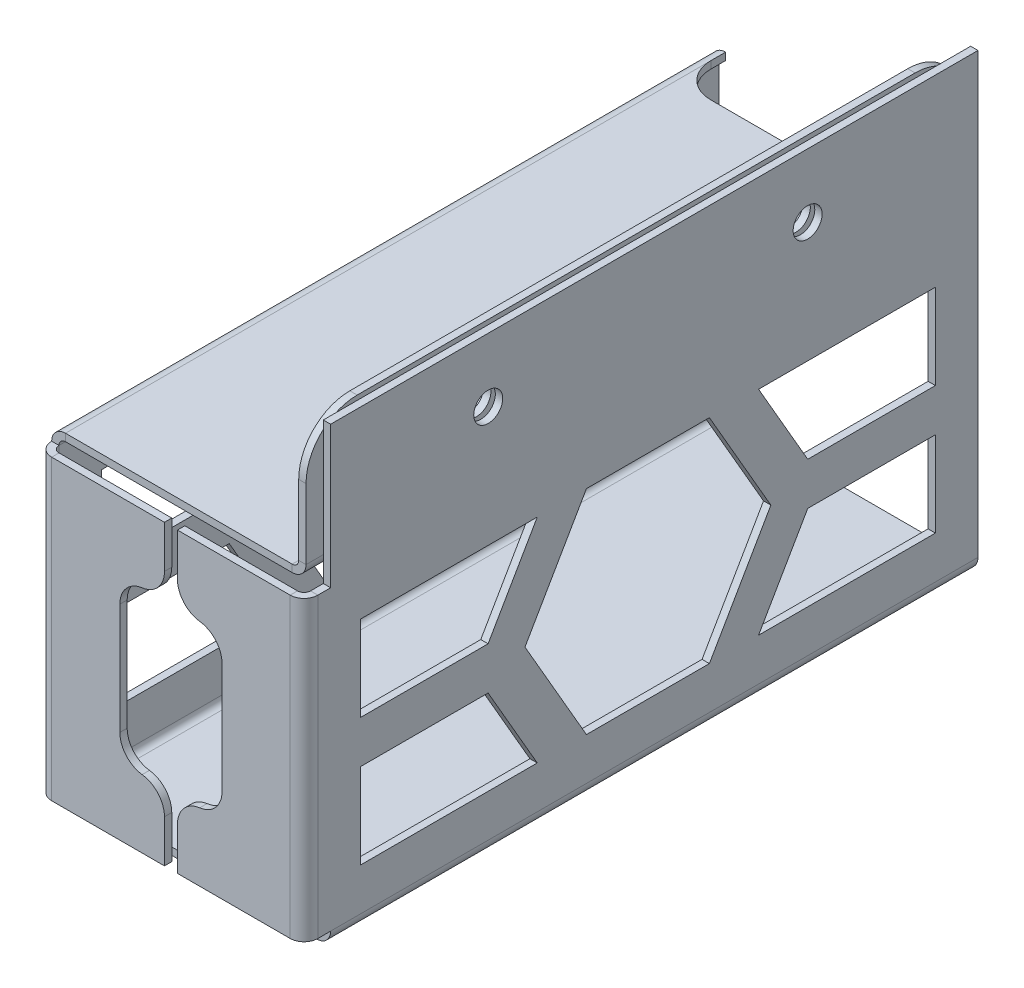
from build123d import *

# Parameters (mm, degrees)
SKETCH1_W                = 24.5
SKETCH1_H                = 76
BASE_FLANGE1_DEPTH       = 0.86
EDGE_FLANGE1_DEPTH       = 76
EDGE_FLANGE4_DEPTH       = 76
EDGE_FLANGE5_DEPTH       = 34.909250773
EDGE_FLANGE6_DEPTH       = 34.938
EDGE_FLANGE7_DEPTH       = 77.5
SKETCH40_W               = 5.238
SKETCH40_H               = 18.938
CUT_EXTRUDE1_DEPTH       = 10
SKETCH41_W               = 5.238
SKETCH41_H               = 18.909250773
CUT_EXTRUDE2_DEPTH       = 10
FILLET1_R                = 3
FILLET2_R                = 3
EDGE_FLANGE9_START       = -38
EDGE_FLANGE9_DEPTH       = 77.5
EDGE_FLANGE9_2_DEPTH     = 77.5
M3_CLEARANCE_HOLE2_D     = 3.4
M3_CLEARANCE_HOLE2_DEPTH = 28.71
M3_CLEARANCE_HOLE2_TIP   = 1.021463052
FILLET4_R                = 6
SKETCH51_W               = 26.616
SKETCH51_H               = 5.735679753
CUT_EXTRUDE4_DEPTH       = 10
FILLET5_R                = 4
HEX_PATTERN_DEPTH        = 74.517332053


# Read off the part's stored shape, not the designer's step: Edge-Flange9
# Sheet-metal steps are written as plain solids
with BuildPart() as part:
    # Sketch1 → Base-Flange1 (new body)
    with BuildSketch(Plane(origin=(0, 0, 0), x_dir=(1, 0, 0), z_dir=(0, 1, 0))):
        Rectangle(SKETCH1_W, SKETCH1_H)
    extrude(amount=-BASE_FLANGE1_DEPTH)

    # Edge-Flange1 section (across the edge) → Edge-Flange1 (add)
    with BuildSketch(Plane(origin=(14.762, 0, 38), x_dir=(-1, 0, 0), z_dir=(0, 0, -1))):
        with BuildLine():
            Line((-0.86, 0.762), (-0.86, 52.3))
            Line((-0.86, 52.3), (0, 52.3))
            Line((0, 52.3), (0, 0.762))
            ThreePointArc((0, 0.762), (0.223184633, 0.223184633), (0.762, 0))
            Line((0.762, 0), (2.512, 0))
            Line((2.512, 0), (2.512, -0.86))
            Line((2.512, -0.86), (0.762, -0.86))
            ThreePointArc((0.762, -0.86), (-0.384927199, -0.384927199), (-0.86, 0.762))
        make_face()
    extrude(amount=EDGE_FLANGE1_DEPTH)

    # Edge-Flange4 section (across the edge) → Edge-Flange4 (add)
    with BuildSketch(Plane(origin=(-14.762, 0, -38), x_dir=(1, 0, 0), z_dir=(0, 0, 1))):
        with BuildLine():
            Line((-0.86, 0.762), (-0.86, 35.7))
            Line((-0.86, 35.7), (0, 35.7))
            Line((0, 35.7), (0, 0.762))
            ThreePointArc((0, 0.762), (0.223184633, 0.223184633), (0.762, 0))
            Line((0.762, 0), (2.512, 0))
            Line((2.512, 0), (2.512, -0.86))
            Line((2.512, -0.86), (0.762, -0.86))
            ThreePointArc((0.762, -0.86), (-0.384927199, -0.384927199), (-0.86, 0.762))
        make_face()
    extrude(amount=EDGE_FLANGE4_DEPTH)

    # Edge-Flange5 section (across the edge) → Edge-Flange5 (add)
    with BuildSketch(Plane(origin=(14.762, 0.762, 40.262), x_dir=(0, 0, -1), z_dir=(0, 1, 0))):
        with BuildLine():
            Line((-0.86, 0.762), (-0.86, 14))
            Line((-0.86, 14), (0, 14))
            Line((0, 14), (0, 0.762))
            ThreePointArc((0, 0.762), (0.223184633, 0.223184633), (0.762, 0))
            Line((0.762, 0), (2.262, 0))
            Line((2.262, 0), (2.262, -0.86))
            Line((2.262, -0.86), (0.762, -0.86))
            ThreePointArc((0.762, -0.86), (-0.384927199, -0.384927199), (-0.86, 0.762))
        make_face()
    extrude(amount=EDGE_FLANGE5_DEPTH)

    # Edge-Flange6 section (across the edge) → Edge-Flange6 (add)
    with BuildSketch(Plane(origin=(-14.762, 35.7, 40.262), x_dir=(0, 0, -1), z_dir=(0, -1, 0))):
        with BuildLine():
            Line((-0.86, 0.762), (-0.86, 14))
            Line((-0.86, 14), (0, 14))
            Line((0, 14), (0, 0.762))
            ThreePointArc((0, 0.762), (0.223184633, 0.223184633), (0.762, 0))
            Line((0.762, 0), (2.262, 0))
            Line((2.262, 0), (2.262, -0.86))
            Line((2.262, -0.86), (0.762, -0.86))
            ThreePointArc((0.762, -0.86), (-0.384927199, -0.384927199), (-0.86, 0.762))
        make_face()
    extrude(amount=EDGE_FLANGE6_DEPTH)

    # Edge-Flange7 section (across the edge) → Edge-Flange7 (add)
    with BuildSketch(Plane(origin=(-14.762, 36.462, -38), x_dir=(0, -1, 0), z_dir=(0, 0, 1))):
        with BuildLine():
            Line((-0.86, 0.762), (-0.86, 29))
            Line((-0.86, 29), (0, 29))
            Line((0, 29), (0, 0.762))
            ThreePointArc((0, 0.762), (0.223184633, 0.223184633), (0.762, 0))
            Line((0.762, 0), (0.762, -0.86))
            ThreePointArc((0.762, -0.86), (-0.384927199, -0.384927199), (-0.86, 0.762))
        make_face()
    extrude(amount=EDGE_FLANGE7_DEPTH)

    # Sketch40 → Cut-Extrude1 (cut)
    with BuildSketch(Plane.XY.offset(41.122)):
        with Locations((-3.381, 18.231)):
            Rectangle(SKETCH40_W, SKETCH40_H)
    extrude(amount=-CUT_EXTRUDE1_DEPTH, mode=Mode.SUBTRACT)

    # Sketch41 → Cut-Extrude2 (cut)
    with BuildSketch(Plane.XY.offset(41.122)):
        with Locations((3.381, 18.216625386)):
            Rectangle(SKETCH41_W, SKETCH41_H)
    extrude(amount=-CUT_EXTRUDE2_DEPTH, mode=Mode.SUBTRACT)

    # Fillet1
    fillet1_edges = [part.edges().sort_by_distance(p)[0] for p in [
        (-0.762, 8.762, 40.692),
        (-0.762, 27.7, 40.692),
        (0.762, 8.762, 40.692),
        (0.762, 27.671250773, 40.692),
    ]]
    fillet(fillet1_edges, radius=FILLET1_R)

    # Fillet2
    fillet2_edges = [part.edges().sort_by_distance(p)[0] for p in [
        (-6, 8.762, 40.692),
        (6, 8.762, 40.692),
        (6, 27.671250773, 40.692),
        (-6, 27.7, 40.692),
    ]]
    fillet(fillet2_edges, radius=FILLET2_R)

    # Edge-Flange9 outline → Edge-Flange9 (cut)
    with BuildSketch(Plane.XY.offset(EDGE_FLANGE9_START)):
        with BuildLine():
            Line((14.238, 37.322), (14.047865915, 37.322))
            ThreePointArc((14.047865915, 37.322), (13.451140707, 36.693523823), (12.616, 36.462))
            Line((12.616, 36.462), (14.238, 36.462))
            Line((14.238, 36.462), (14.238, 37.322))
        make_face()
    extrude(amount=EDGE_FLANGE9_DEPTH, mode=Mode.SUBTRACT)

    # Edge-Flange9 2 outline → Edge-Flange9 2 (add)
    with BuildSketch(Plane.XY.offset(EDGE_FLANGE9_START)):
        with BuildLine():
            ThreePointArc((14.047865915, 37.322), (14.189748791, 37.691318523), (14.238, 38.084))
            Line((14.238, 38.084), (14.238, 52.322))
            Line((14.238, 52.322), (13.378, 52.322))
            Line((13.378, 52.322), (13.378, 38.084))
            ThreePointArc((13.378, 38.084), (13.154815367, 37.545184633), (12.616, 37.322))
            Line((12.616, 37.322), (14.047865915, 37.322))
        make_face()
    extrude(amount=EDGE_FLANGE9_2_DEPTH)

    # M3 Clearance Hole2
    with Locations(Plane.ZY.offset(-13.378)):
        with Locations((-18, 44.822), (19.5, 44.822)):
            Hole(M3_CLEARANCE_HOLE2_D / 2, depth=M3_CLEARANCE_HOLE2_DEPTH)
            with Locations((0, 0, -(M3_CLEARANCE_HOLE2_DEPTH + M3_CLEARANCE_HOLE2_TIP / 2))):  # 118° drill point
                Cone(0, M3_CLEARANCE_HOLE2_D / 2, M3_CLEARANCE_HOLE2_TIP, mode=Mode.SUBTRACT)

    # Fillet4
    fillet4_edges = [part.edges().sort_by_distance(p)[0] for p in [
        (13.808, 52.322, 39.5),
        (13.808, 52.322, -38),
    ]]
    fillet(fillet4_edges, radius=FILLET4_R)

    # Sketch51 → Cut-Extrude4 (cut)
    with BuildSketch(Plane(origin=(0, 37.322, 0), x_dir=(1, 0, 0), z_dir=(0, 1, 0))):
        with Locations((-0.692, 35.132160124)):
            Rectangle(SKETCH51_W, SKETCH51_H)
    extrude(amount=-CUT_EXTRUDE4_DEPTH, mode=Mode.SUBTRACT)

    # Fillet5
    fillet5_edges = [part.edges().sort_by_distance(p)[0] for p in [
        (-14, 36.892, -32.264320247),
        (12.616, 36.892, -32.264320247),
    ]]
    fillet(fillet5_edges, radius=FILLET5_R)

    # Sketch52 → Hex Pattern (cut, through all)
    with BuildSketch(Plane.ZY.offset(15.622)):
        Polygon((13.740381057, 30.731), (34.5, 30.731), (34.5, 20.731), (19.513883749, 20.731), align=None)
        Polygon((15.18375673, 18.231), (7.966878365, 30.731), (-6.466878365, 30.731), (-13.68375673, 18.231), (-6.466878365, 5.731), (7.966878365, 5.731), align=None)
        Polygon((-18.013883749, 20.731), (-12.240381057, 30.731), (-33, 30.731), (-33, 20.731), align=None)
        Polygon((-18.013883749, 15.731), (-12.240381057, 5.731), (-33, 5.731), (-33, 15.731), align=None)
        Polygon((19.513883749, 15.731), (13.740381057, 5.731), (34.5, 5.731), (34.5, 15.731), align=None)
    extrude(amount=-HEX_PATTERN_DEPTH, mode=Mode.SUBTRACT)


solid = part.part
